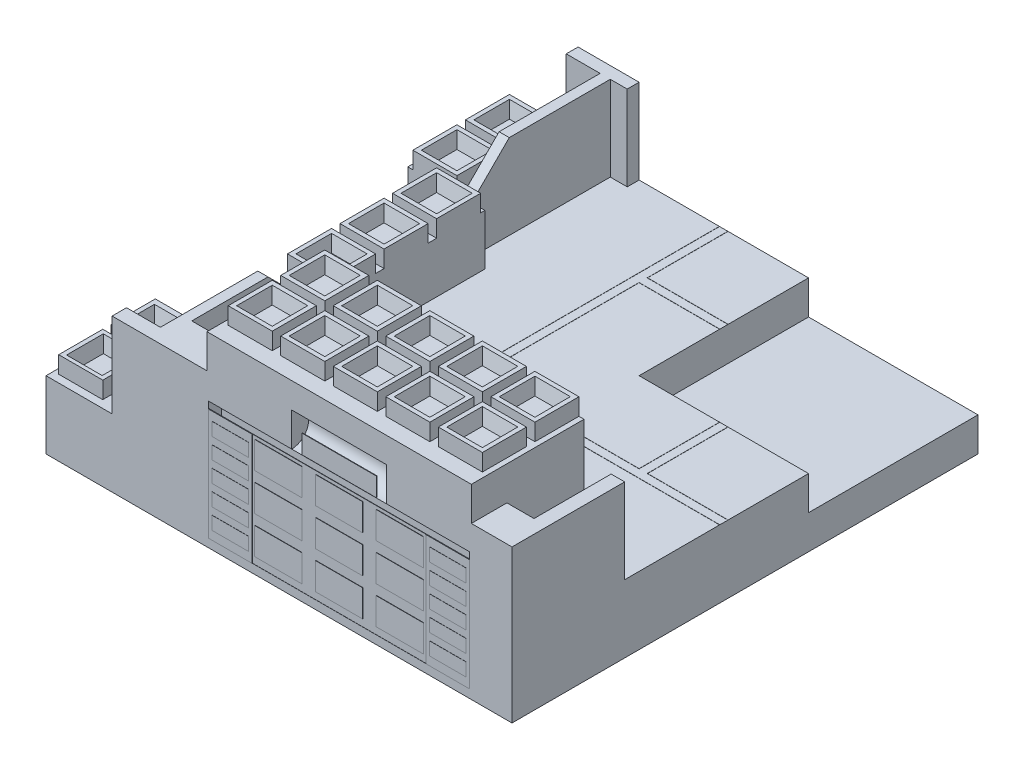
from build123d import *

# Parameters (mm, degrees)
SKETCH_1_W                      = 2750
SKETCH_1_H                      = 2750
EXTRUDE_1_DEPTH                 = 200
EXTRUDE_2_DEPTH                 = 200
SKETCH_4_W                      = 490
SKETCH_4_H                      = 1520
CUT_EXTRUDE_2_DEPTH             = 1200
SKETCH_6_W                      = 260
SKETCH_6_H                      = 260
EXTRUDE_3_DEPTH                 = 100
SKETCH_6_4_W                    = 260
SKETCH_6_4_H                    = 260
EXTRUDE_4_DEPTH                 = 100
SKETCH_7_W                      = 210
SKETCH_7_H                      = 210
CUT_EXTRUDE_3_DEPTH             = 80
CUT_EXTRUDE_3_DRAFT             = -15
CUT_EXTRUDE_3_PROFILE_2_DEPTH   = 80
CUT_EXTRUDE_3_PROFILE_2_DRAFT   = -15
SKETCH_7_H_2                    = 199.942492002
CUT_EXTRUDE_3_PROFILE_3_DEPTH   = 80
CUT_EXTRUDE_3_PROFILE_3_DRAFT   = -15
SKETCH_7_H_3                    = 216.887094488
CUT_EXTRUDE_3_PROFILE_4_DEPTH   = 80
CUT_EXTRUDE_3_PROFILE_4_DRAFT   = -15
SKETCH_8_W                      = 260
SKETCH_8_H                      = 260
EXTRUDE_5_DEPTH                 = 400
SKETCH_9_W                      = 210
SKETCH_9_H                      = 210
CUT_EXTRUDE_4_DEPTH             = 80
CUT_EXTRUDE_4_DRAFT             = -15
CUT_EXTRUDE_4_PROFILE_2_DEPTH   = 80
CUT_EXTRUDE_4_PROFILE_2_DRAFT   = -15
CUT_EXTRUDE_4_PROFILE_3_DEPTH   = 80
CUT_EXTRUDE_4_PROFILE_3_DRAFT   = -15
SKETCH_11_W                     = 260
SKETCH_11_H                     = 50
EXTRUDE_7_DEPTH                 = 300
EXTRUDE_9_DEPTH                 = 500
CUT_EXTRUDE_5_DEPTH             = 2589.556547576
CUT_EXTRUDE_6_DEPTH             = 2667.575519276
EXTRUDE_10_DEPTH                = 500
CUT_EXTRUDE_7_DEPTH             = 2589.556547576
CUT_EXTRUDE_8_DEPTH             = 2667.575519276
SKETCH_28_W                     = 260
SKETCH_28_H                     = 260
EXTRUDE_14_DEPTH                = 700
SKETCH_28_3_W                   = 260
SKETCH_28_3_H                   = 259.71662265
SKETCH_28_3_H_2                 = 260
EXTRUDE_15_DEPTH                = 800
CUT_EXTRUDE_10_DEPTH            = 80
CUT_EXTRUDE_10_DRAFT            = -15
CUT_EXTRUDE_10_PROFILE_2_DEPTH  = 80
CUT_EXTRUDE_10_PROFILE_2_DRAFT  = -15
CUT_EXTRUDE_10_PROFILE_3_DEPTH  = 80
CUT_EXTRUDE_10_PROFILE_3_DRAFT  = -15
CUT_EXTRUDE_10_PROFILE_4_DEPTH  = 80
CUT_EXTRUDE_10_PROFILE_4_DRAFT  = -15
CUT_EXTRUDE_10_PROFILE_5_DEPTH  = 80
CUT_EXTRUDE_10_PROFILE_5_DRAFT  = -15
CUT_EXTRUDE_10_PROFILE_6_DEPTH  = 80
CUT_EXTRUDE_10_PROFILE_6_DRAFT  = -15
CUT_EXTRUDE_10_PROFILE_7_DEPTH  = 80
CUT_EXTRUDE_10_PROFILE_7_DRAFT  = -15
CUT_EXTRUDE_10_PROFILE_8_DEPTH  = 80
CUT_EXTRUDE_10_PROFILE_8_DRAFT  = -15
CUT_EXTRUDE_10_PROFILE_9_DEPTH  = 80
CUT_EXTRUDE_10_PROFILE_9_DRAFT  = -15
CUT_EXTRUDE_10_PROFILE_10_DEPTH = 80
CUT_EXTRUDE_10_PROFILE_10_DRAFT = -15
EXTRUDE_17_DEPTH                = 500
SKETCH_34_W                     = 1540
SKETCH_34_H                     = 700
CUT_EXTRUDE_11_DEPTH            = 70
CUT_EXTRUDE_11_DRAFT            = -5
SKETCH_35_W                     = 560
SKETCH_35_H                     = 100
CUT_REVOLVE_1_ANGLE             = 180
SKETCH_36_W                     = 277.9403716
SKETCH_36_H                     = 159.087745019
SKETCH_36_W_2                   = 256.494284794
SKETCH_36_H_2                   = 660
EXTRUDE_18_DEPTH                = 2
EXTRUDE_19_DEPTH                = 2
SKETCH_39_W                     = 438.389860668
SKETCH_39_H                     = 110.929589382
EXTRUDE_20_DEPTH                = 3
EXTRUDE_21_DEPTH                = 1
SKETCH_42_W                     = 214.976946562
SKETCH_42_H                     = 77.16968448
EXTRUDE_22_DEPTH                = 1


with BuildPart() as part:
    # 草图1 → 凸台-拉伸1 (new body)
    with BuildSketch(Plane(origin=(0, 0, 0), x_dir=(1, 0, 0), z_dir=(0, 1, 0))):
        Rectangle(SKETCH_1_W, SKETCH_1_H)
    extrude(amount=EXTRUDE_1_DEPTH)

    # 草图2 → 凸台-拉伸2 (add)
    with BuildSketch(Plane(origin=(0, 200, 0), x_dir=(1, 0, 0), z_dir=(0, 1, 0))):
        Polygon((375, 375), (375, 1375), (-1375, 1375), (-1375, -1375), (1375, -1375), (1375, 375), align=None)
    extrude(amount=EXTRUDE_2_DEPTH)

    # 草图4 → 切除-拉伸2 (cut)
    with BuildSketch(Plane.XZ):
        with Locations((-1130, 0)):
            Rectangle(SKETCH_4_W, SKETCH_4_H)
    extrude(amount=-CUT_EXTRUDE_2_DEPTH, mode=Mode.SUBTRACT)

    # 草图6 → 凸台-拉伸3 (add)
    with BuildSketch(Plane(origin=(0, 400, 0), x_dir=(1, 0, 0), z_dir=(0, 1, 0))):
        with Locations((-1215, 1200)):
            Rectangle(SKETCH_6_W, SKETCH_6_H)
    extrude(amount=EXTRUDE_3_DEPTH)

    # 草图6<4> → 凸台-拉伸4 (add)
    with BuildSketch(Plane(origin=(0, 400, 0), x_dir=(1, 0, 0), z_dir=(0, 1, 0))):
        with Locations((-1215, -890)):
            Rectangle(SKETCH_6_4_W, SKETCH_6_4_H)
        with Locations((-1215, 890)):
            Rectangle(SKETCH_6_4_W, SKETCH_6_4_H)
        with Locations((-1215, -1200)):
            Rectangle(SKETCH_6_4_W, SKETCH_6_4_H)
    extrude(amount=EXTRUDE_4_DEPTH)


with BuildPart() as cut_extrude_3_tool:
    # 草图7 → 切除-拉伸3 (with draft: the straight prism first)
    with BuildSketch(Plane(origin=(0, 500, 0), x_dir=(1, 0, 0), z_dir=(0, 1, 0))):
        with Locations((-1215, 1200)):
            Rectangle(SKETCH_7_W, SKETCH_7_H)
    extrude(amount=-CUT_EXTRUDE_3_DEPTH)
    # 切除-拉伸3: the draft: its side faces are tilted about the plane it starts from
    cut_extrude_3_sides = [cut_extrude_3_tool.faces().sort_by_distance(p)[0] for p in [
        (-1320, 460, -1200),
        (-1215, 460, -1095),
        (-1110, 460, -1200),
        (-1215, 460, -1305),
    ]]
    draft(cut_extrude_3_sides, Plane(origin=(0, 500, 0), x_dir=(1, 0, 0), z_dir=(0, 1, 0)), CUT_EXTRUDE_3_DRAFT)


with BuildPart() as part_1:
    add(part.part)

    # 切除-拉伸3: cut by cut_extrude_3_tool
    add(cut_extrude_3_tool.part, mode=Mode.SUBTRACT)


with BuildPart() as cut_extrude_3_profile_2_tool:
    # 草图7 → 切除-拉伸3 profile 2 (with draft: the straight prism first)
    with BuildSketch(Plane(origin=(0, 500, 0), x_dir=(1, 0, 0), z_dir=(0, 1, 0))):
        with Locations((-1215, 890)):
            Rectangle(SKETCH_7_W, SKETCH_7_H)
    extrude(amount=-CUT_EXTRUDE_3_PROFILE_2_DEPTH)
    # 切除-拉伸3 profile 2: the draft: its side faces are tilted about the plane it starts from
    cut_extrude_3_profile_2_sides = [cut_extrude_3_profile_2_tool.faces().sort_by_distance(p)[0] for p in [
        (-1320, 460, -890),
        (-1215, 460, -785),
        (-1110, 460, -890),
        (-1215, 460, -995),
    ]]
    draft(cut_extrude_3_profile_2_sides, Plane(origin=(0, 500, 0), x_dir=(1, 0, 0), z_dir=(0, 1, 0)), CUT_EXTRUDE_3_PROFILE_2_DRAFT)


with BuildPart() as part_2:
    add(part_1.part)

    # 切除-拉伸3 profile 2: cut by cut_extrude_3_profile_2_tool
    add(cut_extrude_3_profile_2_tool.part, mode=Mode.SUBTRACT)


with BuildPart() as cut_extrude_3_profile_3_tool:
    # 草图7 → 切除-拉伸3 profile 3 (with draft: the straight prism first)
    with BuildSketch(Plane(origin=(0, 500, 0), x_dir=(1, 0, 0), z_dir=(0, 1, 0))):
        with Locations((-1215, -890)):
            Rectangle(SKETCH_7_W, SKETCH_7_H_2)
    extrude(amount=-CUT_EXTRUDE_3_PROFILE_3_DEPTH)
    # 切除-拉伸3 profile 3: the draft: its side faces are tilted about the plane it starts from
    cut_extrude_3_profile_3_sides = [cut_extrude_3_profile_3_tool.faces().sort_by_distance(p)[0] for p in [
        (-1215, 460, 989.971246001),
        (-1110, 460, 890),
        (-1215, 460, 790.028753999),
        (-1320, 460, 890),
    ]]
    draft(cut_extrude_3_profile_3_sides, Plane(origin=(0, 500, 0), x_dir=(1, 0, 0), z_dir=(0, 1, 0)), CUT_EXTRUDE_3_PROFILE_3_DRAFT)


with BuildPart() as part_3:
    add(part_2.part)

    # 切除-拉伸3 profile 3: cut by cut_extrude_3_profile_3_tool
    add(cut_extrude_3_profile_3_tool.part, mode=Mode.SUBTRACT)


with BuildPart() as cut_extrude_3_profile_4_tool:
    # 草图7 → 切除-拉伸3 profile 4 (with draft: the straight prism first)
    with BuildSketch(Plane(origin=(0, 500, 0), x_dir=(1, 0, 0), z_dir=(0, 1, 0))):
        with Locations((-1215, -1200)):
            Rectangle(SKETCH_7_W, SKETCH_7_H_3)
    extrude(amount=-CUT_EXTRUDE_3_PROFILE_4_DEPTH)
    # 切除-拉伸3 profile 4: the draft: its side faces are tilted about the plane it starts from
    cut_extrude_3_profile_4_sides = [cut_extrude_3_profile_4_tool.faces().sort_by_distance(p)[0] for p in [
        (-1215, 460, 1308.443547244),
        (-1110, 460, 1200),
        (-1215, 460, 1091.556452756),
        (-1320, 460, 1200),
    ]]
    draft(cut_extrude_3_profile_4_sides, Plane(origin=(0, 500, 0), x_dir=(1, 0, 0), z_dir=(0, 1, 0)), CUT_EXTRUDE_3_PROFILE_4_DRAFT)


with BuildPart() as part_4:
    add(part_3.part)

    # 切除-拉伸3 profile 4: cut by cut_extrude_3_profile_4_tool
    add(cut_extrude_3_profile_4_tool.part, mode=Mode.SUBTRACT)

    # 草图8 → 凸台-拉伸5 (add)
    with BuildSketch(Plane(origin=(0, 400, 0), x_dir=(1, 0, 0), z_dir=(0, 1, 0))):
        with Locations((-755, 0)):
            Rectangle(SKETCH_8_W, SKETCH_8_H)
        with Locations((-755, -310)):
            Rectangle(SKETCH_8_W, SKETCH_8_H)
        with Locations((-755, 310)):
            Rectangle(SKETCH_8_W, SKETCH_8_H)
    extrude(amount=EXTRUDE_5_DEPTH)


with BuildPart() as cut_extrude_4_tool:
    # 草图9 → 切除-拉伸4 (with draft: the straight prism first)
    with BuildSketch(Plane(origin=(0, 800, 0), x_dir=(1, 0, 0), z_dir=(0, 1, 0))):
        with Locations((-755, 310)):
            Rectangle(SKETCH_9_W, SKETCH_9_H)
    extrude(amount=-CUT_EXTRUDE_4_DEPTH)
    # 切除-拉伸4: the draft: its side faces are tilted about the plane it starts from
    cut_extrude_4_sides = [cut_extrude_4_tool.faces().sort_by_distance(p)[0] for p in [
        (-650, 760, -310),
        (-755, 760, -415),
        (-860, 760, -310),
        (-755, 760, -205),
    ]]
    draft(cut_extrude_4_sides, Plane(origin=(0, 800, 0), x_dir=(1, 0, 0), z_dir=(0, 1, 0)), CUT_EXTRUDE_4_DRAFT)


with BuildPart() as part_5:
    add(part_4.part)

    # 切除-拉伸4: cut by cut_extrude_4_tool
    add(cut_extrude_4_tool.part, mode=Mode.SUBTRACT)


with BuildPart() as cut_extrude_4_profile_2_tool:
    # 草图9 → 切除-拉伸4 profile 2 (with draft: the straight prism first)
    with BuildSketch(Plane(origin=(0, 800, 0), x_dir=(1, 0, 0), z_dir=(0, 1, 0))):
        with Locations((-755, 0)):
            Rectangle(SKETCH_9_W, SKETCH_9_H)
    extrude(amount=-CUT_EXTRUDE_4_PROFILE_2_DEPTH)
    # 切除-拉伸4 profile 2: the draft: its side faces are tilted about the plane it starts from
    cut_extrude_4_profile_2_sides = [cut_extrude_4_profile_2_tool.faces().sort_by_distance(p)[0] for p in [
        (-650, 760, 0),
        (-755, 760, -105),
        (-860, 760, 0),
        (-755, 760, 105),
    ]]
    draft(cut_extrude_4_profile_2_sides, Plane(origin=(0, 800, 0), x_dir=(1, 0, 0), z_dir=(0, 1, 0)), CUT_EXTRUDE_4_PROFILE_2_DRAFT)


with BuildPart() as part_6:
    add(part_5.part)

    # 切除-拉伸4 profile 2: cut by cut_extrude_4_profile_2_tool
    add(cut_extrude_4_profile_2_tool.part, mode=Mode.SUBTRACT)


with BuildPart() as cut_extrude_4_profile_3_tool:
    # 草图9 → 切除-拉伸4 profile 3 (with draft: the straight prism first)
    with BuildSketch(Plane(origin=(0, 800, 0), x_dir=(1, 0, 0), z_dir=(0, 1, 0))):
        with Locations((-755, -310)):
            Rectangle(SKETCH_9_W, SKETCH_9_H)
    extrude(amount=-CUT_EXTRUDE_4_PROFILE_3_DEPTH)
    # 切除-拉伸4 profile 3: the draft: its side faces are tilted about the plane it starts from
    cut_extrude_4_profile_3_sides = [cut_extrude_4_profile_3_tool.faces().sort_by_distance(p)[0] for p in [
        (-650, 760, 310),
        (-755, 760, 205),
        (-860, 760, 310),
        (-755, 760, 415),
    ]]
    draft(cut_extrude_4_profile_3_sides, Plane(origin=(0, 800, 0), x_dir=(1, 0, 0), z_dir=(0, 1, 0)), CUT_EXTRUDE_4_PROFILE_3_DRAFT)


with BuildPart() as part_7:
    add(part_6.part)

    # 切除-拉伸4 profile 3: cut by cut_extrude_4_profile_3_tool
    add(cut_extrude_4_profile_3_tool.part, mode=Mode.SUBTRACT)

    # 草图11 → 凸台-拉伸7 (add)
    with BuildSketch(Plane(origin=(0, 400, 0), x_dir=(1, 0, 0), z_dir=(0, 1, 0))):
        with Locations((-755, -155)):
            Rectangle(SKETCH_11_W, SKETCH_11_H)
        with Locations((-755, 155)):
            Rectangle(SKETCH_11_W, SKETCH_11_H)
    extrude(amount=EXTRUDE_7_DEPTH)

    # 草图14 → 凸台-拉伸9 (add)
    with BuildSketch(Plane(origin=(0, 400, 0), x_dir=(1, 0, 0), z_dir=(0, 1, 0))):
        Polygon((-625, 1375), (-985, 1375), (-985, 1305), (-785, 1305), (-785, 465), (-885, 465), (-885, 440), (-625, 440), (-625, 465), (-725, 465), (-725, 1305), (-625, 1305), align=None)
    extrude(amount=EXTRUDE_9_DEPTH)

    # 草图15 → 切除-拉伸5 (cut, through all)
    with BuildSketch(Plane(origin=(-625, 0, 0), x_dir=(0, 0, -1), z_dir=(1, 0, 0))):
        Polygon((440, 800), (440, 700), (465, 700), (465, 900), (440, 900), align=None)
    extrude(amount=-CUT_EXTRUDE_5_DEPTH, mode=Mode.SUBTRACT)

    # 草图16 → 切除-拉伸6 (cut, through all)
    with BuildSketch(Plane(origin=(-725, 0, 0), x_dir=(0, 0, -1), z_dir=(1, 0, 0))):
        Polygon((465, 700), (508.825062602, 700), (708.825062602, 900), (465, 900), align=None)
    extrude(amount=-CUT_EXTRUDE_6_DEPTH, mode=Mode.SUBTRACT)

    # 草图18 → 凸台-拉伸10 (add)
    with BuildSketch(Plane(origin=(0, 400, 0), x_dir=(1, 0, 0), z_dir=(0, 1, 0))):
        Polygon((-885, -465), (-785, -465), (-785, -1290), (-985, -1290), (-985, -1375), (-425, -1375), (-425, -1165), (-725, -1165), (-725, -465), (-625, -465), (-625, -440), (-885, -440), align=None)
    extrude(amount=EXTRUDE_10_DEPTH)

    # 草图19 → 切除-拉伸7 (cut, through all)
    with BuildSketch(Plane(origin=(-625, 0, 0), x_dir=(0, 0, -1), z_dir=(1, 0, 0))):
        Polygon((-440, 800), (-440, 700), (-465, 700), (-465, 900), (-440, 900), align=None)
    extrude(amount=-CUT_EXTRUDE_7_DEPTH, mode=Mode.SUBTRACT)

    # 草图20 → 切除-拉伸8 (cut, through all)
    with BuildSketch(Plane(origin=(-725, 0, 0), x_dir=(0, 0, -1), z_dir=(1, 0, 0))):
        Polygon((-465, 700), (-515, 700), (-715, 900), (-465, 900), align=None)
    extrude(amount=-CUT_EXTRUDE_8_DEPTH, mode=Mode.SUBTRACT)

    # 草图28 → 凸台-拉伸14 (add)
    with BuildSketch(Plane(origin=(0, 400, 0), x_dir=(1, 0, 0), z_dir=(0, 1, 0))):
        Polygon((-425, -1375), (1135, -1375), (1135, -710), (1105, -710), (1105, -969.71662265), (845, -969.71662265), (845, -710), (795, -710), (795, -969.71662265), (535, -969.71662265), (535, -710), (485, -710), (485, -969.71662265), (225, -969.71662265), (225, -710), (175, -710), (175, -969.71662265), (-85, -969.71662265), (-85, -710), (-135, -710), (-135, -969.71662265), (-395, -969.71662265), (-395, -710), (-425, -710), align=None)
        with Locations((975, -1149.71662265)):
            Rectangle(SKETCH_28_W, SKETCH_28_H, mode=Mode.SUBTRACT)
        with Locations((-265, -1149.71662265)):
            Rectangle(SKETCH_28_W, SKETCH_28_H, mode=Mode.SUBTRACT)
        with Locations((45, -1149.71662265)):
            Rectangle(SKETCH_28_W, SKETCH_28_H, mode=Mode.SUBTRACT)
        with Locations((355, -1149.71662265)):
            Rectangle(SKETCH_28_W, SKETCH_28_H, mode=Mode.SUBTRACT)
        with Locations((665, -1149.71662265)):
            Rectangle(SKETCH_28_W, SKETCH_28_H, mode=Mode.SUBTRACT)
    extrude(amount=EXTRUDE_14_DEPTH)

    # 草图28<3> → 凸台-拉伸15 (add)
    with BuildSketch(Plane(origin=(0, 400, 0), x_dir=(1, 0, 0), z_dir=(0, 1, 0))):
        with Locations((-265, -839.858311325)):
            Rectangle(SKETCH_28_3_W, SKETCH_28_3_H)
        with Locations((975, -839.858311325)):
            Rectangle(SKETCH_28_3_W, SKETCH_28_3_H)
        with Locations((665, -839.858311325)):
            Rectangle(SKETCH_28_3_W, SKETCH_28_3_H)
        with Locations((355, -839.858311325)):
            Rectangle(SKETCH_28_3_W, SKETCH_28_3_H)
        with Locations((45, -839.858311325)):
            Rectangle(SKETCH_28_3_W, SKETCH_28_3_H)
        with Locations((975, -1149.71662265)):
            Rectangle(SKETCH_28_3_W, SKETCH_28_3_H_2)
        with Locations((45, -1149.71662265)):
            Rectangle(SKETCH_28_3_W, SKETCH_28_3_H_2)
        with Locations((355, -1149.71662265)):
            Rectangle(SKETCH_28_3_W, SKETCH_28_3_H_2)
        with Locations((665, -1149.71662265)):
            Rectangle(SKETCH_28_3_W, SKETCH_28_3_H_2)
        with Locations((-265, -1149.71662265)):
            Rectangle(SKETCH_28_3_W, SKETCH_28_3_H_2)
    extrude(amount=EXTRUDE_15_DEPTH)


with BuildPart() as cut_extrude_10_tool:
    # 草图30 → 切除-拉伸10 (with draft: the straight prism first)
    with BuildSketch(Plane(origin=(0, 1200, 0), x_dir=(1, 0, 0), z_dir=(0, 1, 0))):
        Polygon((-160.000010832, -944.856001742), (-160.984906614, -734.858311325), (-370, -734.858311325), (-370, -944.858311325), align=None)
    extrude(amount=-CUT_EXTRUDE_10_DEPTH)
    # 切除-拉伸10: the draft: its side faces are tilted about the plane it starts from
    cut_extrude_10_sides = [cut_extrude_10_tool.faces().sort_by_distance(p)[0] for p in [
        (-160.492458723, 1160, 839.857156533),
        (-265.492453307, 1160, 734.858311325),
        (-370, 1160, 839.858311325),
        (-265.000005416, 1160, 944.857156533),
    ]]
    draft(cut_extrude_10_sides, Plane(origin=(0, 1200, 0), x_dir=(1, 0, 0), z_dir=(0, 1, 0)), CUT_EXTRUDE_10_DRAFT)


with BuildPart() as part_8:
    add(part_7.part)

    # 切除-拉伸10: cut by cut_extrude_10_tool
    add(cut_extrude_10_tool.part, mode=Mode.SUBTRACT)


with BuildPart() as cut_extrude_10_profile_2_tool:
    # 草图30 → 切除-拉伸10 profile 2 (with draft: the straight prism first)
    with BuildSketch(Plane(origin=(0, 1200, 0), x_dir=(1, 0, 0), z_dir=(0, 1, 0))):
        Polygon((149.999989168, -944.856001742), (149.015093386, -734.858311325), (-60, -734.858311325), (-60, -944.858311325), align=None)
    extrude(amount=-CUT_EXTRUDE_10_PROFILE_2_DEPTH)
    # 切除-拉伸10 profile 2: the draft: its side faces are tilted about the plane it starts from
    cut_extrude_10_profile_2_sides = [cut_extrude_10_profile_2_tool.faces().sort_by_distance(p)[0] for p in [
        (149.507541277, 1160, 839.857156533),
        (44.507546693, 1160, 734.858311325),
        (-60, 1160, 839.858311325),
        (44.999994584, 1160, 944.857156533),
    ]]
    draft(cut_extrude_10_profile_2_sides, Plane(origin=(0, 1200, 0), x_dir=(1, 0, 0), z_dir=(0, 1, 0)), CUT_EXTRUDE_10_PROFILE_2_DRAFT)


with BuildPart() as part_9:
    add(part_8.part)

    # 切除-拉伸10 profile 2: cut by cut_extrude_10_profile_2_tool
    add(cut_extrude_10_profile_2_tool.part, mode=Mode.SUBTRACT)


with BuildPart() as cut_extrude_10_profile_3_tool:
    # 草图30 → 切除-拉伸10 profile 3 (with draft: the straight prism first)
    with BuildSketch(Plane(origin=(0, 1200, 0), x_dir=(1, 0, 0), z_dir=(0, 1, 0))):
        Polygon((459.999989168, -944.856001742), (459.015093386, -734.858311325), (250, -734.858311325), (250, -944.858311325), align=None)
    extrude(amount=-CUT_EXTRUDE_10_PROFILE_3_DEPTH)
    # 切除-拉伸10 profile 3: the draft: its side faces are tilted about the plane it starts from
    cut_extrude_10_profile_3_sides = [cut_extrude_10_profile_3_tool.faces().sort_by_distance(p)[0] for p in [
        (459.507541277, 1160, 839.857156533),
        (354.507546693, 1160, 734.858311325),
        (250, 1160, 839.858311325),
        (354.999994584, 1160, 944.857156533),
    ]]
    draft(cut_extrude_10_profile_3_sides, Plane(origin=(0, 1200, 0), x_dir=(1, 0, 0), z_dir=(0, 1, 0)), CUT_EXTRUDE_10_PROFILE_3_DRAFT)


with BuildPart() as part_10:
    add(part_9.part)

    # 切除-拉伸10 profile 3: cut by cut_extrude_10_profile_3_tool
    add(cut_extrude_10_profile_3_tool.part, mode=Mode.SUBTRACT)


with BuildPart() as cut_extrude_10_profile_4_tool:
    # 草图30 → 切除-拉伸10 profile 4 (with draft: the straight prism first)
    with BuildSketch(Plane(origin=(0, 1200, 0), x_dir=(1, 0, 0), z_dir=(0, 1, 0))):
        Polygon((769.999989168, -944.856001742), (769.015093386, -734.858311325), (560, -734.858311325), (560, -944.858311325), align=None)
    extrude(amount=-CUT_EXTRUDE_10_PROFILE_4_DEPTH)
    # 切除-拉伸10 profile 4: the draft: its side faces are tilted about the plane it starts from
    cut_extrude_10_profile_4_sides = [cut_extrude_10_profile_4_tool.faces().sort_by_distance(p)[0] for p in [
        (769.507541277, 1160, 839.857156533),
        (664.507546693, 1160, 734.858311325),
        (560, 1160, 839.858311325),
        (664.999994584, 1160, 944.857156533),
    ]]
    draft(cut_extrude_10_profile_4_sides, Plane(origin=(0, 1200, 0), x_dir=(1, 0, 0), z_dir=(0, 1, 0)), CUT_EXTRUDE_10_PROFILE_4_DRAFT)


with BuildPart() as part_11:
    add(part_10.part)

    # 切除-拉伸10 profile 4: cut by cut_extrude_10_profile_4_tool
    add(cut_extrude_10_profile_4_tool.part, mode=Mode.SUBTRACT)


with BuildPart() as cut_extrude_10_profile_5_tool:
    # 草图30 → 切除-拉伸10 profile 5 (with draft: the straight prism first)
    with BuildSketch(Plane(origin=(0, 1200, 0), x_dir=(1, 0, 0), z_dir=(0, 1, 0))):
        Polygon((1079.999989168, -944.856001742), (1079.015093386, -734.858311325), (870, -734.858311325), (870, -944.858311325), align=None)
    extrude(amount=-CUT_EXTRUDE_10_PROFILE_5_DEPTH)
    # 切除-拉伸10 profile 5: the draft: its side faces are tilted about the plane it starts from
    cut_extrude_10_profile_5_sides = [cut_extrude_10_profile_5_tool.faces().sort_by_distance(p)[0] for p in [
        (1079.507541277, 1160, 839.857156533),
        (974.507546693, 1160, 734.858311325),
        (870, 1160, 839.858311325),
        (974.999994584, 1160, 944.857156533),
    ]]
    draft(cut_extrude_10_profile_5_sides, Plane(origin=(0, 1200, 0), x_dir=(1, 0, 0), z_dir=(0, 1, 0)), CUT_EXTRUDE_10_PROFILE_5_DRAFT)


with BuildPart() as part_12:
    add(part_11.part)

    # 切除-拉伸10 profile 5: cut by cut_extrude_10_profile_5_tool
    add(cut_extrude_10_profile_5_tool.part, mode=Mode.SUBTRACT)


with BuildPart() as cut_extrude_10_profile_6_tool:
    # 草图30 → 切除-拉伸10 profile 6 (with draft: the straight prism first)
    with BuildSketch(Plane(origin=(0, 1200, 0), x_dir=(1, 0, 0), z_dir=(0, 1, 0))):
        Polygon((149.999989168, -1254.856001741), (149.015093386, -1044.858311325), (-60, -1044.858311325), (-60, -1254.858311325), align=None)
    extrude(amount=-CUT_EXTRUDE_10_PROFILE_6_DEPTH)
    # 切除-拉伸10 profile 6: the draft: its side faces are tilted about the plane it starts from
    cut_extrude_10_profile_6_sides = [cut_extrude_10_profile_6_tool.faces().sort_by_distance(p)[0] for p in [
        (149.507541277, 1160, 1149.857156533),
        (44.507546693, 1160, 1044.858311325),
        (-60, 1160, 1149.858311325),
        (44.999994584, 1160, 1254.857156533),
    ]]
    draft(cut_extrude_10_profile_6_sides, Plane(origin=(0, 1200, 0), x_dir=(1, 0, 0), z_dir=(0, 1, 0)), CUT_EXTRUDE_10_PROFILE_6_DRAFT)


with BuildPart() as part_13:
    add(part_12.part)

    # 切除-拉伸10 profile 6: cut by cut_extrude_10_profile_6_tool
    add(cut_extrude_10_profile_6_tool.part, mode=Mode.SUBTRACT)


with BuildPart() as cut_extrude_10_profile_7_tool:
    # 草图30 → 切除-拉伸10 profile 7 (with draft: the straight prism first)
    with BuildSketch(Plane(origin=(0, 1200, 0), x_dir=(1, 0, 0), z_dir=(0, 1, 0))):
        Polygon((459.999989168, -1254.856001741), (459.015093386, -1044.858311325), (250, -1044.858311325), (250, -1254.858311325), align=None)
    extrude(amount=-CUT_EXTRUDE_10_PROFILE_7_DEPTH)
    # 切除-拉伸10 profile 7: the draft: its side faces are tilted about the plane it starts from
    cut_extrude_10_profile_7_sides = [cut_extrude_10_profile_7_tool.faces().sort_by_distance(p)[0] for p in [
        (459.507541277, 1160, 1149.857156533),
        (354.507546693, 1160, 1044.858311325),
        (250, 1160, 1149.858311325),
        (354.999994584, 1160, 1254.857156533),
    ]]
    draft(cut_extrude_10_profile_7_sides, Plane(origin=(0, 1200, 0), x_dir=(1, 0, 0), z_dir=(0, 1, 0)), CUT_EXTRUDE_10_PROFILE_7_DRAFT)


with BuildPart() as part_14:
    add(part_13.part)

    # 切除-拉伸10 profile 7: cut by cut_extrude_10_profile_7_tool
    add(cut_extrude_10_profile_7_tool.part, mode=Mode.SUBTRACT)


with BuildPart() as cut_extrude_10_profile_8_tool:
    # 草图30 → 切除-拉伸10 profile 8 (with draft: the straight prism first)
    with BuildSketch(Plane(origin=(0, 1200, 0), x_dir=(1, 0, 0), z_dir=(0, 1, 0))):
        Polygon((769.999989168, -1254.856001741), (769.015093386, -1044.858311325), (560, -1044.858311325), (560, -1254.858311325), align=None)
    extrude(amount=-CUT_EXTRUDE_10_PROFILE_8_DEPTH)
    # 切除-拉伸10 profile 8: the draft: its side faces are tilted about the plane it starts from
    cut_extrude_10_profile_8_sides = [cut_extrude_10_profile_8_tool.faces().sort_by_distance(p)[0] for p in [
        (769.507541277, 1160, 1149.857156533),
        (664.507546693, 1160, 1044.858311325),
        (560, 1160, 1149.858311325),
        (664.999994584, 1160, 1254.857156533),
    ]]
    draft(cut_extrude_10_profile_8_sides, Plane(origin=(0, 1200, 0), x_dir=(1, 0, 0), z_dir=(0, 1, 0)), CUT_EXTRUDE_10_PROFILE_8_DRAFT)


with BuildPart() as part_15:
    add(part_14.part)

    # 切除-拉伸10 profile 8: cut by cut_extrude_10_profile_8_tool
    add(cut_extrude_10_profile_8_tool.part, mode=Mode.SUBTRACT)


with BuildPart() as cut_extrude_10_profile_9_tool:
    # 草图30 → 切除-拉伸10 profile 9 (with draft: the straight prism first)
    with BuildSketch(Plane(origin=(0, 1200, 0), x_dir=(1, 0, 0), z_dir=(0, 1, 0))):
        Polygon((1079.999989168, -1254.856001741), (1079.015093386, -1044.858311325), (870, -1044.858311325), (870, -1254.858311325), align=None)
    extrude(amount=-CUT_EXTRUDE_10_PROFILE_9_DEPTH)
    # 切除-拉伸10 profile 9: the draft: its side faces are tilted about the plane it starts from
    cut_extrude_10_profile_9_sides = [cut_extrude_10_profile_9_tool.faces().sort_by_distance(p)[0] for p in [
        (1079.507541277, 1160, 1149.857156533),
        (974.507546693, 1160, 1044.858311325),
        (870, 1160, 1149.858311325),
        (974.999994584, 1160, 1254.857156533),
    ]]
    draft(cut_extrude_10_profile_9_sides, Plane(origin=(0, 1200, 0), x_dir=(1, 0, 0), z_dir=(0, 1, 0)), CUT_EXTRUDE_10_PROFILE_9_DRAFT)


with BuildPart() as part_16:
    add(part_15.part)

    # 切除-拉伸10 profile 9: cut by cut_extrude_10_profile_9_tool
    add(cut_extrude_10_profile_9_tool.part, mode=Mode.SUBTRACT)


with BuildPart() as cut_extrude_10_profile_10_tool:
    # 草图30 → 切除-拉伸10 profile 10 (with draft: the straight prism first)
    with BuildSketch(Plane(origin=(0, 1200, 0), x_dir=(1, 0, 0), z_dir=(0, 1, 0))):
        Polygon((-160.000010832, -1254.856001741), (-160.984906614, -1044.858311325), (-370, -1044.858311325), (-370, -1254.858311325), align=None)
    extrude(amount=-CUT_EXTRUDE_10_PROFILE_10_DEPTH)
    # 切除-拉伸10 profile 10: the draft: its side faces are tilted about the plane it starts from
    cut_extrude_10_profile_10_sides = [cut_extrude_10_profile_10_tool.faces().sort_by_distance(p)[0] for p in [
        (-160.492458723, 1160, 1149.857156533),
        (-265.492453307, 1160, 1044.858311325),
        (-370, 1160, 1149.858311325),
        (-265.000005416, 1160, 1254.857156533),
    ]]
    draft(cut_extrude_10_profile_10_sides, Plane(origin=(0, 1200, 0), x_dir=(1, 0, 0), z_dir=(0, 1, 0)), CUT_EXTRUDE_10_PROFILE_10_DRAFT)


with BuildPart() as part_17:
    add(part_16.part)

    # 切除-拉伸10 profile 10: cut by cut_extrude_10_profile_10_tool
    add(cut_extrude_10_profile_10_tool.part, mode=Mode.SUBTRACT)

    # 草图32 → 凸台-拉伸17 (add)
    with BuildSketch(Plane(origin=(0, 400, 0), x_dir=(1, 0, 0), z_dir=(0, 1, 0))):
        Polygon((1135, -1165), (1295, -1165), (1295, -710), (1375, -710), (1375, -1375), (1135, -1375), align=None)
    extrude(amount=EXTRUDE_17_DEPTH)


with BuildPart() as cut_extrude_11_tool:
    # 草图34 → 切除-拉伸11 (with draft: the straight prism first)
    with BuildSketch(Plane.XY.offset(1375)):
        with Locations((355, 400)):
            Rectangle(SKETCH_34_W, SKETCH_34_H)
    extrude(amount=-CUT_EXTRUDE_11_DEPTH)
    # 切除-拉伸11: the draft: its side faces are tilted about the plane it starts from
    cut_extrude_11_sides = [cut_extrude_11_tool.faces().sort_by_distance(p)[0] for p in [
        (1125, 400, 1340),
        (355, 750, 1340),
        (-415, 400, 1340),
        (355, 50, 1340),
    ]]
    draft(cut_extrude_11_sides, Plane.XY.offset(1375), CUT_EXTRUDE_11_DRAFT)


with BuildPart() as part_18:
    add(part_17.part)

    # 切除-拉伸11: cut by cut_extrude_11_tool
    add(cut_extrude_11_tool.part, mode=Mode.SUBTRACT)

    # 草图35 → 切除-旋转1 (revolve, cut)
    with BuildSketch(Plane.XY.offset(1375)):
        with Locations((355, 800)):
            Rectangle(SKETCH_35_W, SKETCH_35_H)
    revolve(axis=Axis((75, 850, 1375), (1, 0, 0)), revolution_arc=CUT_REVOLVE_1_ANGLE, mode=Mode.SUBTRACT)

    # 草图36 → 凸台-拉伸18 (add)
    with BuildSketch(Plane.XY.offset(1374)):
        with Locations((355, 611.644014611)):
            Rectangle(SKETCH_36_W, SKETCH_36_H)
        with Locations((-286.752857603, 380)):
            Rectangle(SKETCH_36_W_2, SKETCH_36_H_2)
        with Locations((-3.540947609, 611.644014611)):
            Rectangle(SKETCH_36_W, SKETCH_36_H)
        with Locations((713.540947609, 611.644014611)):
            Rectangle(SKETCH_36_W, SKETCH_36_H)
        with Locations((355, 391.64401461)):
            Rectangle(SKETCH_36_W, SKETCH_36_H)
        with Locations((713.540947609, 391.64401461)):
            Rectangle(SKETCH_36_W, SKETCH_36_H)
        with Locations((355, 171.644014611)):
            Rectangle(SKETCH_36_W, SKETCH_36_H)
        with Locations((713.540947609, 171.644014611)):
            Rectangle(SKETCH_36_W, SKETCH_36_H)
        with Locations((-3.540947609, 391.64401461)):
            Rectangle(SKETCH_36_W, SKETCH_36_H)
        with Locations((-3.540947609, 171.644014611)):
            Rectangle(SKETCH_36_W, SKETCH_36_H)
        with Locations((996.752857603, 380)):
            Rectangle(SKETCH_36_W_2, SKETCH_36_H_2)
    extrude(amount=EXTRUDE_18_DEPTH)


with BuildPart() as extrude_18_piece_1:
    # of the separate pieces the step leaves, piece 1, a body of its own (extrude_18_pieces)
    add(part_18.part.solids().sort_by_distance((1375, 0, 1375))[0])



with BuildPart() as extrude_18_piece_2:
    # of the separate pieces the step leaves, piece 2, a body of its own (extrude_18_pieces)
    add(part_18.part.solids().sort_by_distance((574.570761809, 251.18788712, 1374))[0])


with BuildPart() as extrude_18_piece_3:
    # of the separate pieces the step leaves, piece 3, a body of its own (extrude_18_pieces)
    add(part_18.part.solids().sort_by_distance((216.0298142, 471.18788712, 1374))[0])


with BuildPart() as extrude_18_piece_4:
    # of the separate pieces the step leaves, piece 4, a body of its own (extrude_18_pieces)
    add(part_18.part.solids().sort_by_distance((216.0298142, 251.18788712, 1374))[0])


with BuildPart() as extrude_18_piece_5:
    # of the separate pieces the step leaves, piece 5, a body of its own (extrude_18_pieces)
    add(part_18.part.solids().sort_by_distance((-142.511133409, 251.18788712, 1374))[0])


with BuildPart() as extrude_18_piece_6:
    # of the separate pieces the step leaves, piece 6, a body of its own (extrude_18_pieces)
    add(part_18.part.solids().sort_by_distance((-142.511133409, 471.18788712, 1374))[0])


with BuildPart() as extrude_18_piece_7:
    # of the separate pieces the step leaves, piece 7, a body of its own (extrude_18_pieces)
    add(part_18.part.solids().sort_by_distance((216.0298142, 691.18788712, 1374))[0])


with BuildPart() as extrude_18_piece_8:
    # of the separate pieces the step leaves, piece 8, a body of its own (extrude_18_pieces)
    add(part_18.part.solids().sort_by_distance((574.570761809, 691.18788712, 1374))[0])


with BuildPart() as extrude_18_piece_9:
    # of the separate pieces the step leaves, piece 9, a body of its own (extrude_18_pieces)
    add(part_18.part.solids().sort_by_distance((574.570761809, 471.18788712, 1374))[0])


with BuildPart() as extrude_18_piece_10:
    # of the separate pieces the step leaves, piece 10, a body of its own (extrude_18_pieces)
    add(part_18.part.solids().sort_by_distance((-142.511133409, 691.18788712, 1374))[0])


with BuildPart() as extrude_18_piece_1_1:
    add(extrude_18_piece_1.part)

    add(extrude_18_piece_2.part)  # 凸台-拉伸19 merges 凸台-拉伸18 piece 2

    add(extrude_18_piece_3.part)  # 凸台-拉伸19 merges 凸台-拉伸18 piece 3

    add(extrude_18_piece_4.part)  # 凸台-拉伸19 merges 凸台-拉伸18 piece 4

    add(extrude_18_piece_5.part)  # 凸台-拉伸19 merges 凸台-拉伸18 piece 5

    add(extrude_18_piece_6.part)  # 凸台-拉伸19 merges 凸台-拉伸18 piece 6

    add(extrude_18_piece_7.part)  # 凸台-拉伸19 merges 凸台-拉伸18 piece 7

    add(extrude_18_piece_8.part)  # 凸台-拉伸19 merges 凸台-拉伸18 piece 8

    add(extrude_18_piece_9.part)  # 凸台-拉伸19 merges 凸台-拉伸18 piece 9

    add(extrude_18_piece_10.part)  # 凸台-拉伸19 merges 凸台-拉伸18 piece 10
    # 草图38 → 凸台-拉伸19 (add)
    with BuildSketch(Plane.XY.offset(1374)):
        Polygon((-158.505715206, 710), (-415, 710), (-415, 50), (-158.505715206, 50), (868.505715206, 50), (1125, 50), (1125, 710), (868.505715206, 710), align=None)
    extrude(amount=-EXTRUDE_19_DEPTH)

    # 草图39 → 凸台-拉伸20 (add)
    with BuildSketch(Plane.XY.offset(1374)):
        with Locations((355, 805.464794691)):
            Rectangle(SKETCH_39_W, SKETCH_39_H)
    extrude(amount=-EXTRUDE_20_DEPTH)

    # 草图41 → 凸台-拉伸21 (add)
    with BuildSketch(Plane(origin=(0, 400, 0), x_dir=(1, 0, 0), z_dir=(0, 1, 0))):
        Polygon((400, -710), (400, -150), (1375, -150), (1375, -149), (399, -149), (399, -710), align=None)
        Polygon((-100, 1375), (-101, 1375), (-101, 899), (375, 899), (375, 900), (-100, 900), align=None)
        Polygon((-625, 25), (-625, 24), (-150, 24), (-150, 1375), (-151, 1375), (-151, 25), align=None)
        with BuildLine():
            Line((349, -710), (350, -710))
            Line((350, -710), (350, -150))
            Line((350, -150), (-120, -150))
            ThreePointArc((-120, -150), (-141.213203436, -141.213203436), (-150, -120))
            Line((-150, -120), (-150, -25))
            Line((-150, -25), (-625, -25))
            Line((-625, -25), (-625, -26))
            Line((-625, -26), (-151, -26))
            Line((-151, -26), (-151, -120))
            ThreePointArc((-151, -120), (-141.920310217, -141.920310217), (-120, -151))
            Line((-120, -151), (349, -151))
            Line((349, -151), (349, -710))
        make_face()
        with BuildLine():
            Line((851, -101), (851, 375))
            Line((851, 375), (850, 375))
            Line((850, 375), (850, -100))
            Line((850, -100), (-70, -100))
            ThreePointArc((-70, -100), (-91.213203436, -91.213203436), (-100, -70))
            Line((-100, -70), (-100, 850))
            Line((-100, 850), (375, 850))
            Line((375, 850), (375, 851))
            Line((375, 851), (-101, 851))
            Line((-101, 851), (-101, -70))
            ThreePointArc((-101, -70), (-91.920310217, -91.920310217), (-70, -101))
            Line((-70, -101), (851, -101))
        make_face()
        Polygon((899, -101), (1375, -101), (1375, -100), (900, -100), (900, 375), (899, 375), align=None)
    extrude(amount=EXTRUDE_21_DEPTH)

    # 草图42 → 凸台-拉伸22 (add)
    with BuildSketch(Plane.XY.offset(1376)):
        with Locations((-286.752857603, 500)):
            Rectangle(SKETCH_42_W, SKETCH_42_H)
        with Locations((-286.752857603, 380)):
            Rectangle(SKETCH_42_W, SKETCH_42_H)
        with Locations((-286.752857603, 620)):
            Rectangle(SKETCH_42_W, SKETCH_42_H)
        with Locations((-286.752857603, 260)):
            Rectangle(SKETCH_42_W, SKETCH_42_H)
        with Locations((-286.752857603, 140)):
            Rectangle(SKETCH_42_W, SKETCH_42_H)
        with Locations((996.752857603, 140)):
            Rectangle(SKETCH_42_W, SKETCH_42_H)
        with Locations((996.752857603, 260)):
            Rectangle(SKETCH_42_W, SKETCH_42_H)
        with Locations((996.752857603, 380)):
            Rectangle(SKETCH_42_W, SKETCH_42_H)
        with Locations((996.752857603, 500)):
            Rectangle(SKETCH_42_W, SKETCH_42_H)
        with Locations((996.752857603, 620)):
            Rectangle(SKETCH_42_W, SKETCH_42_H)
    extrude(amount=EXTRUDE_22_DEPTH)


solid = extrude_18_piece_1_1.part
